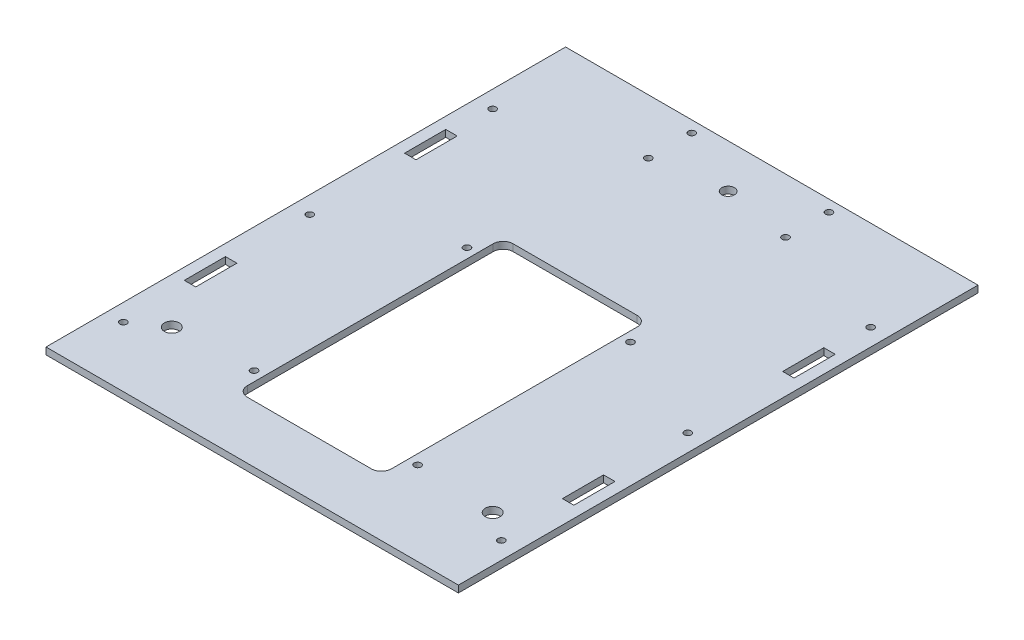
from build123d import *

# Parameters (mm, degrees)
SCHIZZO1_W                   = 180.34
SCHIZZO1_H                   = 227.22
ESTRUSIONE_ESTRUSIONE1_DEPTH = 3
SCHIZZO2_R                   = 1.5
SCHIZZO2_R_2                 = 3.25
SCHIZZO2_R_3                 = 2.75
SCHIZZO2_W                   = 5
SCHIZZO2_H                   = 18
TAGLIO_ESTRUSIONE1_DEPTH     = 146.075363174
SCHIZZO3_R                   = 1.5
TAGLIO_ESTRUSIONE5_DEPTH     = 146.075363174


with BuildPart() as part:
    # Schizzo1 → Estrusione-Estrusione1 (new body)
    with BuildSketch(Plane(origin=(0, 0, 0), x_dir=(1, 0, 0), z_dir=(0, 1, 0))):
        Rectangle(SCHIZZO1_W, SCHIZZO1_H)
    extrude(amount=ESTRUSIONE_ESTRUSIONE1_DEPTH)

    # Schizzo2 → Taglio-Estrusione1 (cut, through all)
    with BuildSketch(Plane(origin=(0, 0, 0), x_dir=(1, 0, 0), z_dir=(0, 1, 0))):
        with Locations((-82.67, -5.81)):
            Circle(SCHIZZO2_R)
        with Locations((-82.67, -87.31)):
            Circle(SCHIZZO2_R)
        with Locations((-82.67, 74.19)):
            Circle(SCHIZZO2_R)
        with Locations((82.67, -87.31)):
            Circle(SCHIZZO2_R)
        with Locations((82.67, -5.81)):
            Circle(SCHIZZO2_R)
        with Locations((82.67, 74.19)):
            Circle(SCHIZZO2_R)
        with Locations((-70.17, -78.61)):
            Circle(SCHIZZO2_R_2)
        with Locations((70.17, -78.61)):
            Circle(SCHIZZO2_R_2)
        with Locations((-30, 89.61)):
            Circle(SCHIZZO2_R)
        with Locations((-30, 108.61)):
            Circle(SCHIZZO2_R)
        with Locations((30, 89.61)):
            Circle(SCHIZZO2_R)
        with Locations((30, 108.61)):
            Circle(SCHIZZO2_R)
        with Locations((0, 94.51)):
            Circle(SCHIZZO2_R_3)
        with Locations((82.67, -49.13)):
            Rectangle(SCHIZZO2_W, SCHIZZO2_H)
        with Locations((-82.67, -49.13)):
            Rectangle(SCHIZZO2_W, SCHIZZO2_H)
        with Locations((-82.67, 47.19)):
            Rectangle(SCHIZZO2_W, SCHIZZO2_H)
        with Locations((82.67, 47.19)):
            Rectangle(SCHIZZO2_W, SCHIZZO2_H)
    extrude(amount=TAGLIO_ESTRUSIONE1_DEPTH, mode=Mode.SUBTRACT)

    # Schizzo3 → Taglio-Estrusione5 (cut, through all)
    with BuildSketch(Plane(origin=(0, 0, 0), x_dir=(1, 0, 0), z_dir=(0, 1, 0))):
        with Locations((-35.75, -77.045)):
            Circle(SCHIZZO3_R)
        with Locations((35.75, -77.045)):
            Circle(SCHIZZO3_R)
        with Locations((-35.75, 16.055)):
            Circle(SCHIZZO3_R)
        with Locations((35.75, 16.055)):
            Circle(SCHIZZO3_R)
        with BuildLine():
            Line((-31.5, -84.26), (-31.5, 23.27))
            ThreePointArc((-31.5, 23.27), (-30.225914498, 26.345914498), (-27.15, 27.62))
            Line((-27.15, 27.62), (27.15, 27.62))
            ThreePointArc((27.15, 27.62), (30.225914498, 26.345914498), (31.5, 23.27))
            Line((31.5, 23.27), (31.5, -84.26))
            ThreePointArc((31.5, -84.26), (30.225914498, -87.335914498), (27.15, -88.61))
            Line((27.15, -88.61), (-27.15, -88.61))
            ThreePointArc((-27.15, -88.61), (-30.225914498, -87.335914498), (-31.5, -84.26))
        make_face()
    extrude(amount=TAGLIO_ESTRUSIONE5_DEPTH, mode=Mode.SUBTRACT)


solid = part.part
